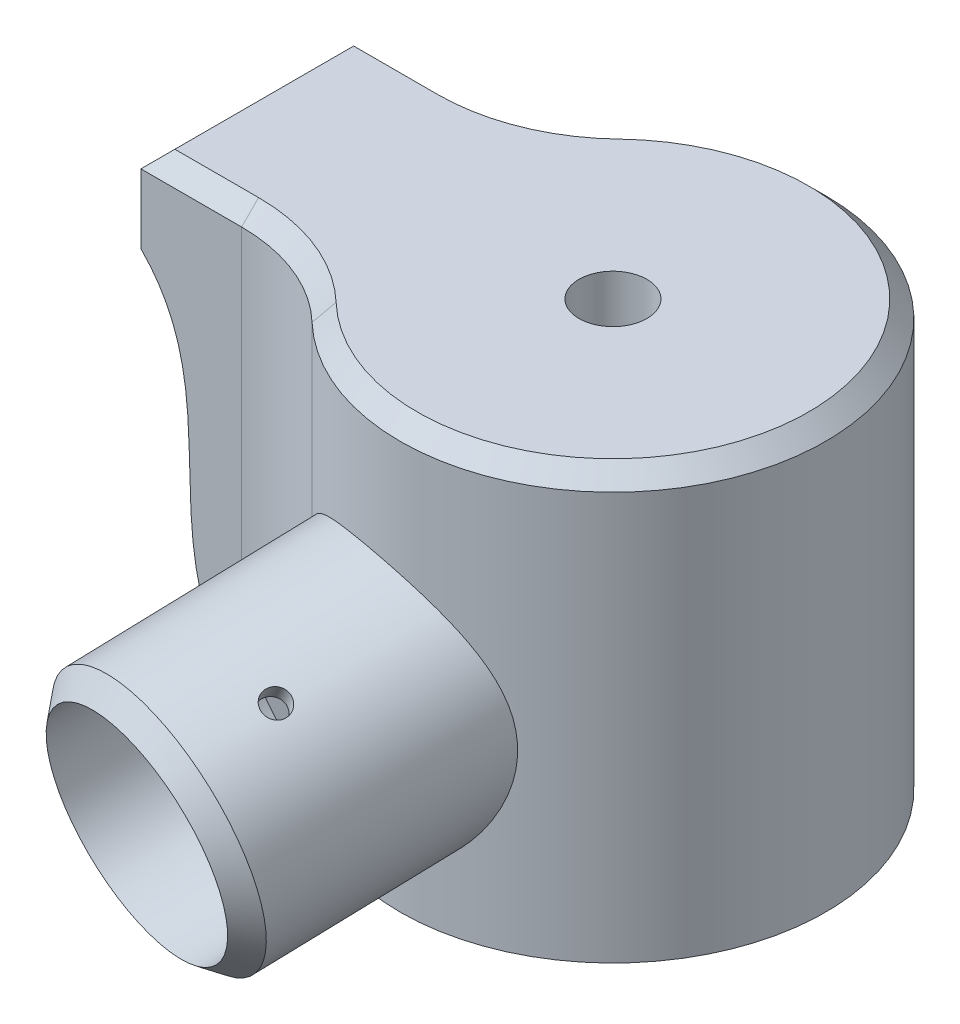
from build123d import *

# Parameters (mm, degrees)
BOSS_EXTRUDE2_DEPTH = 50
CHAMFER1_SIZE       = 2
SKETCH3_R           = 15
BOSS_EXTRUDE3_DEPTH = 50
SKETCH5_R           = 12.7
CUT_EXTRUDE1_DEPTH  = 21
CHAMFER2_SIZE       = 3
SKETCH6_R           = 1.5
CUT_EXTRUDE2_DEPTH  = 48.5
SKETCH7_R           = 4
CUT_EXTRUDE3_DEPTH  = 82
SKETCH9_R           = 11
CUT_EXTRUDE4_DEPTH  = 8
CHAMFER3_SIZE       = 2
CUT_EXTRUDE5_DEPTH  = 96


with BuildPart() as part:
    # Sketch1 → Boss-Extrude2 (new body)
    with BuildSketch(Plane(origin=(0, 0, 0), x_dir=(1, 0, 0), z_dir=(0, 1, 0))):
        with BuildLine():
            Line((-34.047744375, -12.524843262), (-22.18855037, -12.524843262))
            ThreePointArc((-22.18855037, -12.524843262), (-14.720176785, -13.968492225), (-8.327835606, -18.091440268))
            ThreePointArc((-8.327835606, -18.091440268), (34.047744375, 0), (-8.327835606, 18.091440268))
            ThreePointArc((-8.327835606, 18.091440268), (-14.720176785, 13.968492225), (-22.18855037, 12.524843262))
            Line((-22.18855037, 12.524843262), (-34.047744375, 12.524843262))
            Line((-34.047744375, 12.524843262), (-34.047744375, -12.524843262))
        make_face()
    extrude(amount=BOSS_EXTRUDE2_DEPTH)

    # Chamfer1
    chamfer1_edges = [part.edges().sort_by_distance(p)[0] for p in [
        (-14.720176785, 50, 13.968492225),
        (34.047744375, 50, 0),
        (-14.720176785, 50, -13.968492225),
        (-28.118147372, 50, -12.524843262),
        (-28.118147372, 50, 12.524843262),
    ]]
    chamfer(chamfer1_edges, length=CHAMFER1_SIZE)

    # Sketch3 → Boss-Extrude3 (add)
    with BuildSketch(Plane(origin=(8.99805785, 25, 0), x_dir=(0.9847817818042102, -0.03725406297903357, 0.1697556391348433), z_dir=(-0.17379325152773012, -0.2062305980482824, 0.9629459206788651))):
        with Locations(Location((0, 0, 0), (0, 0, 159.473102118))):
            Circle(SKETCH3_R)
    extrude(amount=BOSS_EXTRUDE3_DEPTH)

    # Sketch5 → Cut-Extrude1 (cut)
    with BuildSketch(Plane(origin=(-7.521847234, -8.925749647, 41.676716708), x_dir=(0.9847817818042102, -0.03725406297903372, 0.16975563913484326), z_dir=(-0.17379325152773012, -0.2062305980482824, 0.9629459206788651))):
        with Locations(Location((7.929771868, 24.45263149, 0), (0, 0, 270.050317468))):
            Circle(SKETCH5_R)
    extrude(amount=-CUT_EXTRUDE1_DEPTH, mode=Mode.SUBTRACT)

    # Chamfer2
    # the kernel refuses this chamfer: 3 mm, written as the material it takes off along each edge
    with BuildSketch(Plane(origin=(0.308395273, 14.688470098, 48.147296034), x_dir=(-0.9219524467114961, 0.37774931122051036, -0.08549353118871512), z_dir=(0.3461207762127333, 0.9026485463906081, 0.255785085516762))) as chamfer2_piece_1:
        Polygon((15, -CHAMFER2_SIZE), (15 - CHAMFER2_SIZE, 0), (15, 0), align=None)
    revolve(axis=Axis((0.308395273, 14.688470098, 48.147296034), (-0.17379325152773012, -0.20623059804828237, 0.9629459206788651)), mode=Mode.SUBTRACT)

    # Sketch6 → Cut-Extrude2 (cut, symmetric)
    with BuildSketch(Plane(origin=(-22.18855037, 48, -12.524843262), x_dir=(-0.8657900557986787, 0.47372232177796453, 0.16122884707587404), z_dir=(-0.500365768548969, -0.82370873989167, -0.26671709635956337))):
        with Locations(Location((-27.977220625, -56.414440492, 0), (0, 0, 189.630227826))):
            Circle(SKETCH6_R)
    extrude(amount=CUT_EXTRUDE2_DEPTH, both=True, mode=Mode.SUBTRACT)

    # Sketch7 → Cut-Extrude3 (cut)
    with BuildSketch(Plane(origin=(0, 0, 0), x_dir=(-1, 0, 0), z_dir=(0, -1, 0))):
        with Locations(Location((-8.99805785, 0, 0), (0, 0, 90))):
            Circle(SKETCH7_R)
    extrude(amount=-CUT_EXTRUDE3_DEPTH, mode=Mode.SUBTRACT)

    # Sketch9 → Cut-Extrude4 (cut)
    with BuildSketch(Plane.XZ):
        with Locations(Location((8.99805785, 0, 0), (0, 0, 270))):
            Circle(SKETCH9_R)
    extrude(amount=-CUT_EXTRUDE4_DEPTH, mode=Mode.SUBTRACT)

    # Chamfer3
    chamfer3_edges = [part.edges().sort_by_distance(p)[0] for p in [
        (-34.047744375, 50, 0),
    ]]
    chamfer(chamfer3_edges, length=CHAMFER3_SIZE)

    # Sketch10 → Cut-Extrude5 (cut)
    with BuildSketch(Plane(origin=(0, 0, -12.524843262), x_dir=(-1, 0, 0), z_dir=(0, 0, -1))):
        with BuildLine():
            Line((22.186659572, 0), (34.047744375, 0))
            Line((34.047744375, 0), (34.047744375, 39.859182783))
            add(Edge.make_bspline(
                [(22.186659572, 0), (33.554101307, 11.263767606), (23.164669735, 28.934314706), (34.047744375, 39.859182783)],
                knots=[0, 0, 0, 0, 1, 1, 1, 1], degree=3))
        make_face()
    extrude(amount=-CUT_EXTRUDE5_DEPTH, mode=Mode.SUBTRACT)


solid = part.part
